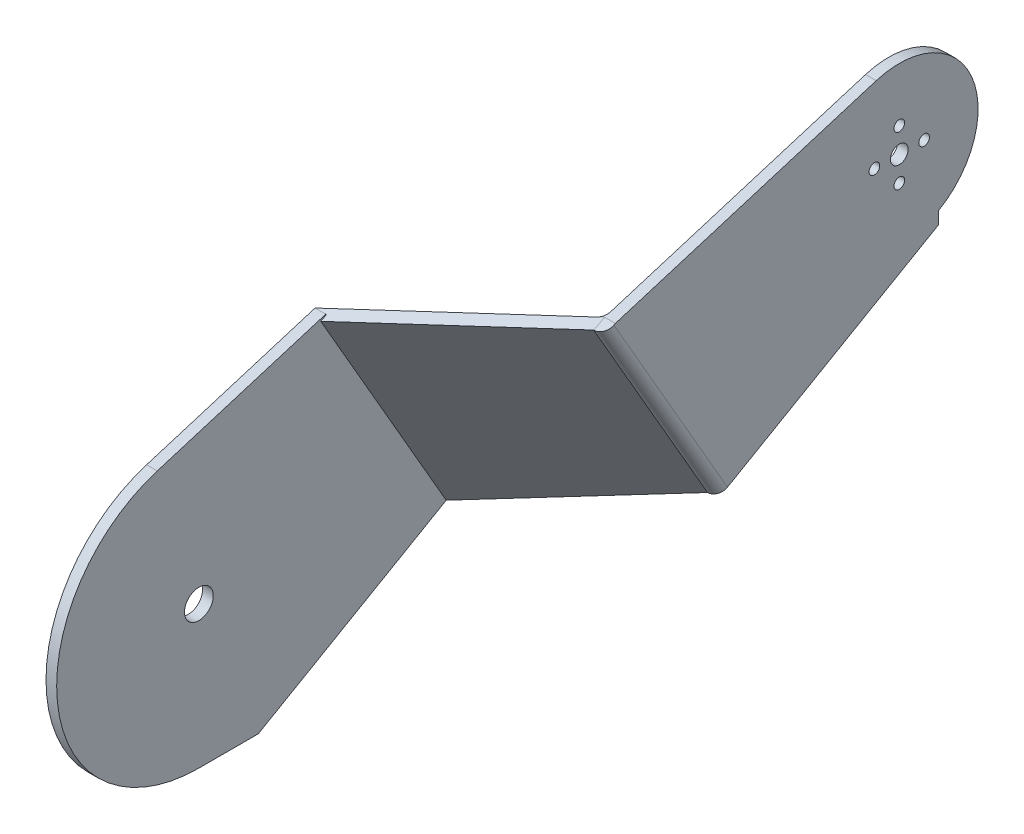
from build123d import *

# Parameters (mm, degrees)
SKETCH_2_R           = 3
SKETCH_2_R_2         = 1.5
SKETCH_2_R_3         = 2.5
EXTRUDE_1_DEPTH      = 3
EXTRUDE_2_DEPTH      = 196
SKETCH_5_R           = 8
CUT_EXTRUDE_1_DEPTH  = 10
SKETCH_6_R           = 4.05
CUT_EXTRUDE_2_DEPTH  = 10
SKETCH_8_R           = 40
EXTRUDE_3_DEPTH      = 3
EXTRUDE_START        = -61
EXTRUDE_4_DEPTH      = 64
EXTRUDE_5_DEPTH      = 3
EXTRUDE_START_2      = -3
EXTRUDE_14_DEPTH     = 3
EXTRUDE_15_DEPTH     = 3
SKETCH_16_R          = 40
EXTRUDE_16_DEPTH     = 3
CUT_EXTRUDE_START    = -20
CUT_EXTRUDE_5_DEPTH  = 20
CUT_EXTRUDE_6_DEPTH  = 20
CUT_EXTRUDE_7_DEPTH  = 3
FILLET_3_R           = 3
FILLET_4_R           = 3
FILLET_5_R           = 3
FILLET_6_R           = 3
SKETCH_22_R          = 7.75
CUT_EXTRUDE_8_DEPTH  = 10
SKETCH_23_R          = 4.05
CUT_EXTRUDE_9_DEPTH  = 10
CUT_EXTRUDE_10_DEPTH = 10
SKETCH_25_W          = 514.702896461
SKETCH_25_H          = 285.568662858
CUT_EXTRUDE_11_DEPTH = 80


# Some blends are built 0.0001 mm under size
with BuildPart() as part:
    # 草图2 → 凸台-拉伸1 (new body)
    with BuildSketch(Plane(origin=(0, 0, 0), x_dir=(0, 0, -1), z_dir=(1, 0, 0))):
        with BuildLine():
            Line((138.514809283, 84.200667909), (-11.70063651, 38.25042621))
            ThreePointArc((-11.70063651, 38.25042621), (-39.560188627, -5.915359313), (0, -40))
            Line((0, -40), (16.710190716, -40))
            Line((16.710190716, -40), (156.071648789, 40.329376559))
            Line((156.071648789, 40.329376559), (156.071648789, 43.792069046))
            ThreePointArc((156.071648789, 43.792069046), (165.334026038, 71.834783727), (138.514809283, 84.200667909))
        make_face()
        Circle(SKETCH_2_R, mode=Mode.SUBTRACT)
        with Locations((145, 70)):
            Circle(SKETCH_2_R_2, mode=Mode.SUBTRACT)
        with Locations((138, 63)):
            Circle(SKETCH_2_R_2, mode=Mode.SUBTRACT)
        with Locations((145, 56)):
            Circle(SKETCH_2_R_2, mode=Mode.SUBTRACT)
        with Locations((145, 63)):
            Circle(SKETCH_2_R_3, mode=Mode.SUBTRACT)
        with Locations((152, 63)):
            Circle(SKETCH_2_R_2, mode=Mode.SUBTRACT)
    extrude_1 = extrude(amount=EXTRUDE_1_DEPTH)

    # 草图4 → 凸台-拉伸2 (add)
    with BuildSketch(Plane(origin=(3, 0, 0), x_dir=(0, 0, -1), z_dir=(1, 0, 0))):
        with BuildLine():
            Line((0, -40), (16.710190716, -40))
            Line((16.710190716, -40), (156.071648789, 40.329376559))
            Line((156.071648789, 40.329376559), (156.071648789, 43.792069046))
            Line((156.071648789, 43.792069046), (19.975563357, -34.655113166))
            ThreePointArc((19.975563357, -34.655113166), (10.339136167, -38.640681455), (0, -40))
        make_face()
    extrude(amount=EXTRUDE_2_DEPTH)

    # 镜向2: 凸台-拉伸1 across plane
    add(extrude_1.mirror(Plane(origin=(101, 0, 0), x_dir=(0, 0, 1), z_dir=(1, 0, 0))))

    # 草图5 → 切除-拉伸1 (cut)
    with BuildSketch(Plane(origin=(202, 0, 0), x_dir=(0, 0, -1), z_dir=(1, 0, 0))):
        Circle(SKETCH_5_R)
    extrude(amount=-CUT_EXTRUDE_1_DEPTH, mode=Mode.SUBTRACT)

    # 草图6 → 切除-拉伸2 (cut)
    with BuildSketch(Plane.ZY):
        Circle(SKETCH_6_R)
    extrude(amount=-CUT_EXTRUDE_2_DEPTH, mode=Mode.SUBTRACT)

    # 草图9 → 凸台-拉伸4 (add)
    with BuildSketch(Plane(origin=(251, 0, 0), x_dir=(0, 0, -1), z_dir=(1, 0, 0)).offset(EXTRUDE_START)):
        with BuildLine():
            Line((0, -40), (16.710190716, -40))
            Line((16.710190716, -40), (53.747942483, -18.651059269))
            Line((53.747942483, -18.651059269), (52.249775231, -16.051925781))
            Line((52.249775231, -16.051925781), (19.975563357, -34.655113166))
            ThreePointArc((19.975563357, -34.655113166), (10.339136167, -38.640681455), (0, -40))
        make_face()
    extrude_4 = extrude(amount=EXTRUDE_4_DEPTH)

    # 草图10 → 凸台-拉伸5 (add)
    with BuildSketch(Plane(origin=(0, -37.254246654, -21.473730609), x_dir=(1, 0, 0), z_dir=(0, -0.8663778291595938, -0.49938908392225567))):
        Polygon((254, -37.251890328), (254, -57.251890328), (202, -87.274104325), (202, -37.251890328), align=None)
    extrude_5 = extrude(amount=-EXTRUDE_5_DEPTH)



with BuildPart() as body_2:
    # 草图8 → 凸台-拉伸3 (new body)
    with BuildSketch(Plane(origin=(251, 0, 0), x_dir=(0, 0, -1), z_dir=(1, 0, 0))):
        Circle(SKETCH_8_R)
    extrude(amount=EXTRUDE_3_DEPTH)


with BuildPart() as part_1:
    add(part.part)

    add(body_2.part)  # 凸台-拉伸14 merges body 2
    # 草图14 → 凸台-拉伸14 (add)
    with BuildSketch(Plane(origin=(254, 0, 0), x_dir=(0, 0, -1), z_dir=(1, 0, 0)).offset(EXTRUDE_START_2)):
        with BuildLine():
            Line((-11.70063651, 38.25042621), (35.679778873, 52.743886101))
            Line((35.679778873, 52.743886101), (69.577331814, -6.064144103))
            Line((69.577331814, -6.064144103), (19.975563357, -34.655113166))
            ThreePointArc((19.975563357, -34.655113166), (36.686823541, 15.939792297), (-11.70063651, 38.25042621))
        make_face()
    extrude_14 = extrude(amount=EXTRUDE_14_DEPTH)

    # 草图15 → 凸台-拉伸15 (add)
    with BuildSketch(Plane(origin=(88.290795719, 76.368648195, -132.490087928), x_dir=(-0.8660254037844362, 0.24969454196113003, -0.4331889145798008), z_dir=(0.5000000000000044, 0.4324836330493111, -0.7503052093278204))):
        Polygon((-191.344507397, -43), (-191.344507397, 27.878041456), (-131.300079402, 20.97393325), (-131.300079402, -43), align=None)
    extrude_15 = extrude(amount=-EXTRUDE_15_DEPTH)

    # 镜向8: 凸台-拉伸15 across plane
    add(extrude_15.mirror(Plane(origin=(101, 0, 0), x_dir=(0, 0, 1), z_dir=(1, 0, 0))))

    # 镜向10: 凸台-拉伸5 across plane
    add(extrude_5.mirror(Plane(origin=(101, 0, 0), x_dir=(0, 0, 1), z_dir=(1, 0, 0))))

    # 镜向11: 凸台-拉伸4 across plane
    add(extrude_4.mirror(Plane(origin=(101, 0, 0), x_dir=(0, 0, 1), z_dir=(1, 0, 0))))

    # 镜向12: 凸台-拉伸14 across plane
    add(extrude_14.mirror(Plane(origin=(101, 0, 0), x_dir=(0, 0, 1), z_dir=(1, 0, 0))))

    # 草图16 → 凸台-拉伸16 (add)
    with BuildSketch(Plane.ZY.offset(52)):
        Circle(SKETCH_16_R)
    extrude(amount=-EXTRUDE_16_DEPTH)

    # 草图17 → 切除-拉伸5 (cut)
    with BuildSketch(Plane(origin=(202, 0, 0), x_dir=(0, 0, -1), z_dir=(1, 0, 0)).offset(CUT_EXTRUDE_START)):
        with BuildLine():
            Line((-11.120326036, 38.423148607), (61.739147636, 60.715331959))
            Line((61.739147636, 60.715331959), (65.138195736, 61.755085767))
            Line((65.138195736, 61.755085767), (62.037518083, 60.197696416))
            Line((62.037518083, 60.197696416), (92.586691567, 7.198687311))
            Line((92.586691567, 7.198687311), (19.975563357, -34.655113166))
            ThreePointArc((19.975563357, -34.655113166), (-36.806411031, -15.66167638), (-11.120326036, 38.423148607))
        make_face()
    extrude(amount=CUT_EXTRUDE_5_DEPTH, mode=Mode.SUBTRACT)


with BuildPart() as cut_extrude_5_piece_1:
    # of the separate pieces the step leaves, piece 1, a body of its own (cut_extrude_5_pieces)
    add(part_1.part.solids().sort_by_distance((0, 43.792069046, -156.071648789))[0])

    # 草图21 → 切除-拉伸7 (cut)
    with BuildSketch(Plane(origin=(3, 0, 0), x_dir=(0, 0, -1), z_dir=(1, 0, 0))):
        with BuildLine():
            Line((92.586691567, 7.198687311), (62.037518083, 60.197696416))
            Line((62.037518083, 60.197696416), (65.138195736, 61.755085767))
            Line((65.138195736, 61.755085767), (61.739147636, 60.715331959))
            Line((61.739147636, 60.715331959), (-11.70063651, 38.25042621))
            ThreePointArc((-11.70063651, 38.25042621), (-36.686823541, -15.939792297), (19.975563357, -34.655113166))
            Line((19.975563357, -34.655113166), (92.586691567, 7.198687311))
        make_face()
    extrude(amount=-CUT_EXTRUDE_7_DEPTH, mode=Mode.SUBTRACT)

    # 圆角3
    fillet_3_edges = [cut_extrude_5_piece_1.edges().sort_by_distance(p)[0] for p in [
        (3, 33.698191863, -77.312104825),
    ]]
    fillet(fillet_3_edges, radius=FILLET_3_R - 0.0001)  # a hair under: the kernel refuses the full size

    # 圆角4
    fillet_4_edges = [cut_extrude_5_piece_1.edges().sort_by_distance(p)[0] for p in [
        (199, 33.698191863, -77.312104825),
    ]]
    fillet(fillet_4_edges, radius=FILLET_4_R - 0.0001)  # a hair under: the kernel refuses the full size

    # 圆角5
    # the kernel refuses this fillet: 3 mm, written as the material it adds along each edge
    with BuildSketch(Plane(origin=(202, 65.506611814, -62.97577757), x_dir=(0, 0.49938908392225534, -0.8663778291595939), z_dir=(0, -0.866377829159594, -0.4993890839222554))) as fillet_5_piece_1_section:
        with BuildLine():
            CenterArc((FILLET_5_R * 0.57735026919, FILLET_5_R), FILLET_5_R, 210, 60)
            Line((-FILLET_5_R * 0.288675134595, FILLET_5_R * 0.5), (0, 0))
            Line((0, 0), (FILLET_5_R * 0.57735026919, 0))
        make_face()
    fillet_5_piece_1 = extrude(amount=68.304060269, mode=Mode.PRIVATE)
    fillet_5_piece_1 = split(fillet_5_piece_1, bisect_by=Plane(origin=(202.325553984, 63.906694987, -72.171998522), z_dir=(0, -0.9562606552534866, -0.2925159127537726)), keep=Keep.TOP, mode=Mode.PRIVATE)
    fillet_5_piece_1 = split(fillet_5_piece_1, bisect_by=Plane(origin=(199.177617764, 62.412552566, -67.072312804), z_dir=(0.09892666816624712, -0.8892295154916122, -0.44663674625368427)), keep=Keep.TOP, mode=Mode.PRIVATE)
    add(fillet_5_piece_1)

    # 圆角6
    # the kernel refuses this fillet: 3 mm, written as the material it adds along each edge
    with BuildSketch(Plane(origin=(0, 6.329488355, -97.086079656), x_dir=(2.017234182721707e-14, 0.49938908392225534, -0.8663778291595939), z_dir=(0, 0.8663778291595939, 0.4993890839222554))) as fillet_6_piece_1_section:
        with BuildLine():
            CenterArc((FILLET_6_R * 0.57735026919, FILLET_6_R), FILLET_6_R, 210, 60)
            Line((-FILLET_6_R * 0.288675134595, FILLET_6_R * 0.5), (0, 0))
            Line((0, 0), (FILLET_6_R * 0.57735026919, 0))
        make_face()
    fillet_6_piece_1 = extrude(amount=68.304060269, mode=Mode.PRIVATE)
    fillet_6_piece_1 = split(fillet_6_piece_1, bisect_by=Plane(origin=(-0.325553984, 63.906694987, -72.171998522), z_dir=(0, -0.9562606552534866, -0.2925159127537726)), keep=Keep.TOP, mode=Mode.PRIVATE)
    fillet_6_piece_1 = split(fillet_6_piece_1, bisect_by=Plane(origin=(2.822382236, 62.412552566, -67.072312804), z_dir=(-0.09892666816624712, -0.8892295154916122, -0.44663674625368427)), keep=Keep.TOP, mode=Mode.PRIVATE)
    add(fillet_6_piece_1)

    # 草图22 → 切除-拉伸8 (cut)
    with BuildSketch(Plane(origin=(254, 0, 0), x_dir=(0, 0, -1), z_dir=(1, 0, 0))):
        Circle(SKETCH_22_R)
    extrude(amount=-CUT_EXTRUDE_8_DEPTH, mode=Mode.SUBTRACT)

    # 草图23 → 切除-拉伸9 (cut)
    with BuildSketch(Plane.ZY.offset(52)):
        Circle(SKETCH_23_R)
    extrude(amount=-CUT_EXTRUDE_9_DEPTH, mode=Mode.SUBTRACT)

    # 草图24 → 切除-拉伸10 (cut)
    with BuildSketch(Plane(origin=(0, -37.254246654, -21.473730609), x_dir=(1, 0, 0), z_dir=(0, -0.8663778291595938, -0.49938908392225567))):
        with BuildLine():
            Line((-49, 40), (-49, -55.51983952))
            Line((-49, -55.51983952), (0, -83.81000271))
            ThreePointArc((0, -83.81000271), (2.121320344, -84.688682367), (3, -86.81000271))
            Line((3, -86.81000271), (3, -87.274104325))
            Line((3, -87.274104325), (3, -179.256683584))
            Line((3, -179.256683584), (199, -179.256683584))
            Line((199, -179.256683584), (199, -87.274104325))
            Line((199, -87.274104325), (199, -86.81000271))
            ThreePointArc((199, -86.81000271), (199.878679656, -84.688682367), (202, -83.81000271))
            Line((202, -83.81000271), (251, -55.51983952))
            Line((251, -55.51983952), (251, 40))
            Line((251, 40), (-49, 40))
        make_face()
    extrude(amount=-CUT_EXTRUDE_10_DEPTH, mode=Mode.SUBTRACT)


with BuildPart() as cut_extrude_5_piece_2:
    # of the separate pieces the step leaves, piece 2, a body of its own (cut_extrude_5_pieces)
    add(part_1.part.solids().sort_by_distance((202, 60.715331959, -61.739147636))[0])

    # 草图18 → 切除-拉伸6 (cut)
    with BuildSketch(Plane(origin=(0, 38.25042621, 11.70063651), x_dir=(1, 0, 0), z_dir=(0, 0.9562606552534866, 0.2925159127537726))):
        Polygon((199, 76.798918519), (202, 76.932821805), (202, 0), (199, 0), align=None)
    extrude(amount=-CUT_EXTRUDE_6_DEPTH, mode=Mode.SUBTRACT)


with BuildPart() as cut_extrude_10_piece_1:
    # of the separate pieces the step leaves, piece 1, a body of its own (cut_extrude_10_pieces)
    add(cut_extrude_5_piece_1.part.solids().sort_by_distance((-1.5, 5.897004722, -96.335774447))[0])


with BuildPart() as cut_extrude_10_piece_2:
    # of the separate pieces the step leaves, piece 2, a body of its own (cut_extrude_10_pieces)
    add(cut_extrude_5_piece_1.part.solids().sort_by_distance((199, 6.097721075, -96.683992306))[0])

    # 草图25 → 切除-拉伸11 (cut)
    with BuildSketch(Plane(origin=(254, 0, 0), x_dir=(0, 0, -1), z_dir=(1, 0, 0))):
        with Locations((-76.2896691, 93.84361465)):
            Rectangle(SKETCH_25_W, SKETCH_25_H)
    extrude(amount=-CUT_EXTRUDE_11_DEPTH, mode=Mode.SUBTRACT)


solid = cut_extrude_10_piece_1.part
